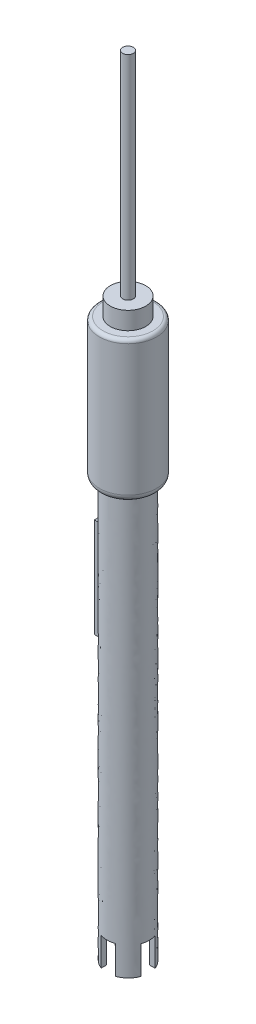
from build123d import *

# Parameters (mm, degrees)
REDONDEO1_R                  = 2
CROQUIS2_R                   = 5
SALIENTE_EXTRUIR1_DEPTH      = 5
REDONDEO2_R                  = 1
CROQUIS3_R                   = 1.5
SALIENTE_EXTRUIR2_DEPTH      = 60
CROQUIS4_W                   = 16.15
CROQUIS4_H                   = 16.15
CROQUIS4_RX                  = 6
CROQUIS4_RY                  = 5.9
CORTAR_EXTRUIR1_DEPTH        = 117.5
CROQUIS5_W                   = 6
CROQUIS5_H                   = 28
SALIENTE_EXTRUIR3_DEPTH      = 6.5
CROQUIS6_W                   = 12
CROQUIS6_H                   = 4
CROQUIS6_W_2                 = 4
CROQUIS6_H_2                 = 11.8
CORTAR_EXTRUIR_L_MINA1_DEPTH = 8
CROQUIS7_R                   = 4.5
CORTAR_EXTRUIR2_DEPTH        = 8


with BuildPart() as part:
    # Croquis1 → Revolución1 (revolve)
    with BuildSketch(Plane.XY, mode=Mode.PRIVATE) as revoluci_n1_sk:
        Polygon((0, 0), (6.25, 0), (6.25, 117.5), (8.075, 117.5), (8.075, 157.5), (0, 157.5), align=None)
    revolve(revoluci_n1_sk.sketch.rotate(Axis((0, 0, 0), (0, -1, 0)), 90), axis=Axis((0, 0, 0), (0, -1, 0)))

    # Redondeo1
    # the kernel refuses this fillet: 2 mm, written as the material it takes off along each edge
    with BuildSketch(Plane(origin=(0, 117.5, 0), x_dir=(0, 0, 1), z_dir=(1, 0, 0))) as redondeo1_piece_1:
        with BuildLine():
            CenterArc((6.075, -1.992329039), REDONDEO1_R, 0, 84.980199868)
            Line((8.075, -1.992329039), (8.115, -1.992329039))
            Line((8.115, -1.992329039), (8.115, 0))
            Line((8.115, 0), (8.075, 0.04))
            ThreePointArc((8.075, 0.04), (7.1625, 0.04), (6.2535, 0.039846581))
            Line((6.2535, 0.039846581), (6.25, 0))
        make_face()
    revolve(axis=Axis((0, 117.5, 0), (0, -1, 0)), mode=Mode.SUBTRACT)

    # Croquis2 → Saliente-Extruir1 (add)
    with BuildSketch(Plane(origin=(0, 157.5, 0), x_dir=(1, 0, 0), z_dir=(0, 1, 0))):
        with Locations(Location((0, 0, 0), (0, 0, 270))):
            Circle(CROQUIS2_R)
    extrude(amount=SALIENTE_EXTRUIR1_DEPTH)

    # Redondeo2
    redondeo2_edges = [part.edges().sort_by_distance(p)[0] for p in [
        (0, 157.5, -8.075),
    ]]
    fillet(redondeo2_edges, radius=REDONDEO2_R)

    # Croquis3 → Saliente-Extruir2 (add)
    with BuildSketch(Plane(origin=(0, 162.5, 0), x_dir=(1, 0, 0), z_dir=(0, 1, 0))):
        with Locations(Location((0, 0, 0), (0, 0, 90))):
            Circle(CROQUIS3_R)
    extrude(amount=SALIENTE_EXTRUIR2_DEPTH)

    # Croquis4 → Cortar-Extruir1 (cut)
    with BuildSketch(Plane.XZ):
        Rectangle(CROQUIS4_W, CROQUIS4_H)
        with Locations(Location((0, 0), (0, 0, 180))):
            Ellipse(CROQUIS4_RX, CROQUIS4_RY, mode=Mode.SUBTRACT)
    extrude(amount=-CORTAR_EXTRUIR1_DEPTH, mode=Mode.SUBTRACT)

    # Croquis5 → Saliente-Extruir3 (add)
    with BuildSketch(Plane(origin=(0, 0, 0), x_dir=(0, 0, -1), z_dir=(1, 0, 0))):
        with Locations((0, 92)):
            Rectangle(CROQUIS5_W, CROQUIS5_H)
    extrude(amount=-SALIENTE_EXTRUIR3_DEPTH)

    # Croquis6 → Cortar-Extruir-Lámina1 (cut)
    with BuildSketch(Plane.XZ):
        Rectangle(CROQUIS6_W, CROQUIS6_H)
        Rectangle(CROQUIS6_W_2, CROQUIS6_H_2)
    extrude(amount=-CORTAR_EXTRUIR_L_MINA1_DEPTH, mode=Mode.SUBTRACT)

    # Croquis7 → Cortar-Extruir2 (cut)
    with BuildSketch(Plane.XZ):
        Circle(CROQUIS7_R)
    extrude(amount=-CORTAR_EXTRUIR2_DEPTH, mode=Mode.SUBTRACT)


solid = part.part
